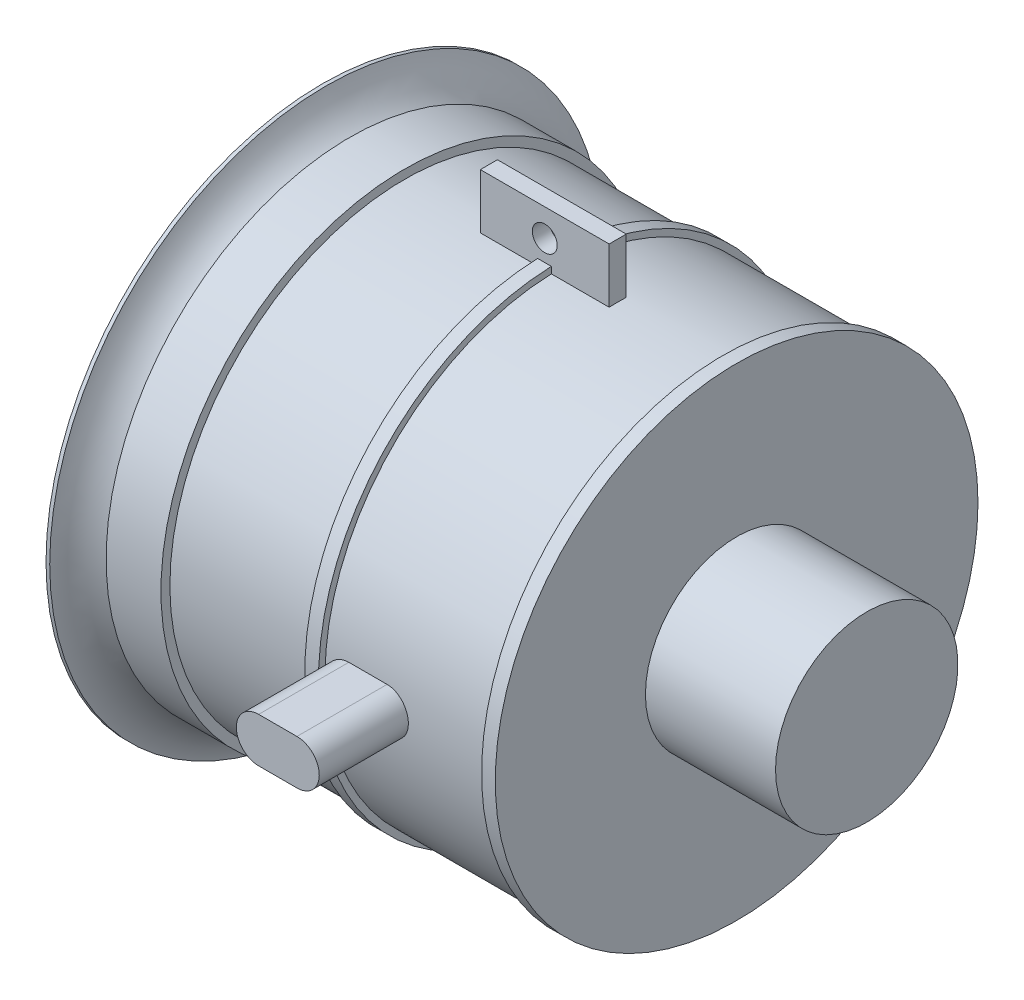
from build123d import *

# Parameters (mm, degrees)
SKETCH1_R                = 43.3
BOSS_EXTRUDE1_DEPTH      = 0.58
BOSS_EXTRUDE2_START      = -0.58
SKETCH2_R                = 36.83
BOSS_EXTRUDE2_DEPTH      = 65
BOSS_EXTRUDE3_DEPTH      = 1.34
BOSS_EXTRUDE3_DEPTH_BACK = 1.34
SKETCH3_W                = 20.2
SKETCH3_H                = 90.8
SKETCH3_R                = 1.95
BOSS_EXTRUDE4_START      = 64.42
SKETCH4_R                = 37.849999992
BOSS_EXTRUDE4_DEPTH      = 2.15
BOSS_EXTRUDE5_START      = 36.703
SKETCH4_2_R              = 37.849999992
BOSS_EXTRUDE5_DEPTH      = 2.15
BOSS_EXTRUDE6_START      = -65
SKETCH5_R                = 14.299999975
BOSS_EXTRUDE6_DEPTH      = 85.4
BOSS_EXTRUDE7_DEPTH      = 50.8
FILLET1_R                = 8.89
BOSS_EXTRUDE8_START      = -65
SKETCH6_R                = 38.227
BOSS_EXTRUDE8_DEPTH      = 12.954


with BuildPart() as part:
    # Sketch1 → Boss-Extrude1 (new body)
    with BuildSketch(Plane(origin=(0, 0, 0), x_dir=(0, 0, -1), z_dir=(1, 0, 0))):
        Circle(SKETCH1_R)
    extrude(amount=BOSS_EXTRUDE1_DEPTH)

    # Sketch2 → Boss-Extrude2 (add)
    with BuildSketch(Plane(origin=(0.58, 0, 0), x_dir=(0, 0, -1), z_dir=(1, 0, 0)).offset(BOSS_EXTRUDE2_START)):
        Circle(SKETCH2_R)
    extrude(amount=BOSS_EXTRUDE2_DEPTH)

    # Sketch3 → Boss-Extrude3 (add, two sides: drawn at the far end of the back side and taken through both)
    with BuildSketch(Plane.XY.offset(-BOSS_EXTRUDE3_DEPTH_BACK)):
        with Locations((36.25, 0)):
            Rectangle(SKETCH3_W, SKETCH3_H)
        with Locations((36.25, 41.115)):
            Circle(SKETCH3_R, mode=Mode.SUBTRACT)
        with Locations((36.25, -41.115)):
            Circle(SKETCH3_R, mode=Mode.SUBTRACT)
    extrude(amount=BOSS_EXTRUDE3_DEPTH + BOSS_EXTRUDE3_DEPTH_BACK)

    # Sketch4 → Boss-Extrude4 (add)
    with BuildSketch(Plane(origin=(0.58, 0, 0), x_dir=(0, 0, -1), z_dir=(1, 0, 0)).offset(BOSS_EXTRUDE4_START)):
        Circle(SKETCH4_R)
    extrude(amount=-BOSS_EXTRUDE4_DEPTH)

    # Sketch4<2> → Boss-Extrude5 (add)
    with BuildSketch(Plane(origin=(0.58, 0, 0), x_dir=(0, 0, -1), z_dir=(1, 0, 0)).offset(BOSS_EXTRUDE5_START)):
        Circle(SKETCH4_2_R)
    extrude(amount=-BOSS_EXTRUDE5_DEPTH)

    # Sketch5 → Boss-Extrude6 (add)
    with BuildSketch(Plane(origin=(65, 0, 0), x_dir=(0, 0, -1), z_dir=(1, 0, 0)).offset(BOSS_EXTRUDE6_START)):
        with Locations(Location((0, 0, 0), (0, 0, 180))):
            Circle(SKETCH5_R)
    extrude(amount=BOSS_EXTRUDE6_DEPTH)

    # Sketch3<3> → Boss-Extrude7 (add)
    with BuildSketch(Plane.XY):
        with BuildLine():
            Line((40.850706358, 3.5), (46.850706358, 3.5))
            ThreePointArc((46.850706358, 3.5), (50.350706358, 0), (46.850706358, -3.5))
            Line((46.850706358, -3.5), (40.850706358, -3.5))
            ThreePointArc((40.850706358, -3.5), (37.350706358, 0), (40.850706358, 3.5))
        make_face()
    extrude(amount=BOSS_EXTRUDE7_DEPTH)

    # Fillet1
    # the kernel refuses this fillet: 8.89 mm, written as the material it adds along each edge
    with BuildSketch(Plane(origin=(0.58, 0, 0), x_dir=(0, 0, -1), z_dir=(0, 1, 0))) as fillet1_piece_1:
        with BuildLine():
            CenterArc((45.72, -8.554279631), FILLET1_R, 105.796172805, 74.203827195)
            Line((36.83, -8.554279631), (36.6522, -8.554279631))
            Line((36.6522, -8.554279631), (36.6522, 0))
            Line((36.6522, 0), (36.83, 0.1778))
            ThreePointArc((36.83, 0.1778), (40.065, 0.1778), (43.2516, 0.171085593))
            Line((43.2516, 0.171085593), (43.3, 0))
        make_face()
    revolve(axis=Axis((0.58, 0, 0), (-1, 0, 0)))

    # Sketch6 → Boss-Extrude8 (add)
    with BuildSketch(Plane(origin=(65, 0, 0), x_dir=(0, 0, -1), z_dir=(1, 0, 0)).offset(BOSS_EXTRUDE8_START)):
        Circle(SKETCH6_R)
    extrude(amount=BOSS_EXTRUDE8_DEPTH)


solid = part.part
